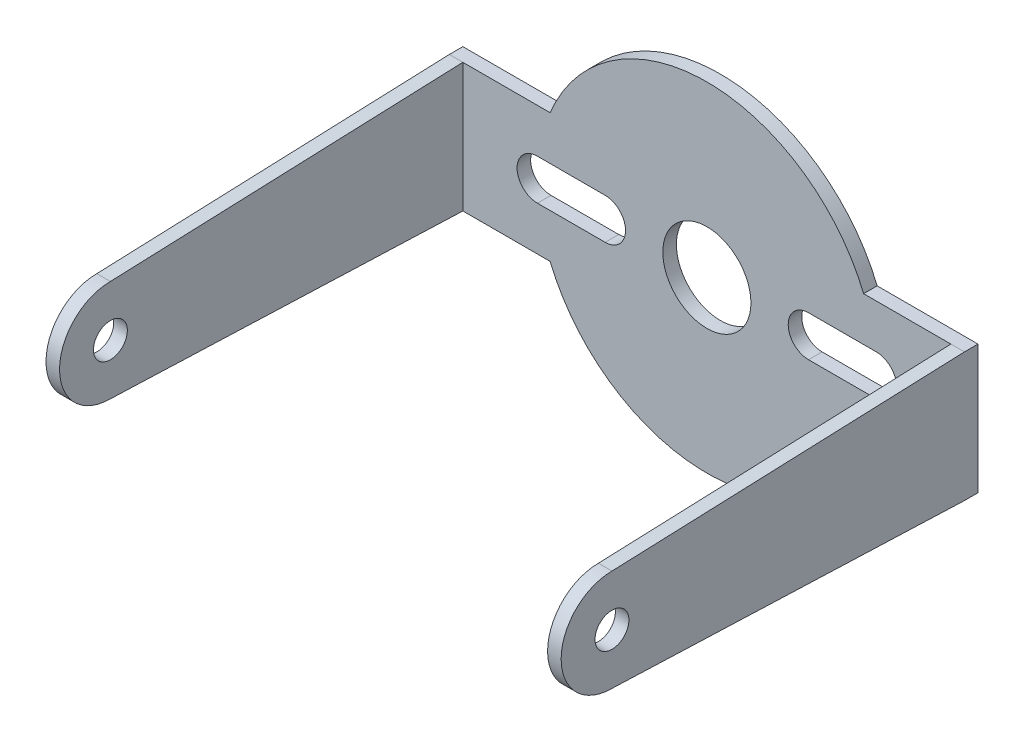
from build123d import *

# Parameters (mm, degrees)
SKETCH_1_R                = 3.25
EXTRUDE_1_DEPTH           = 1
HOLE_WIZARD_3_0_3_1_DEPTH = 1
SKETCH_7_R                = 1.25
EXTRUDE_2_DEPTH           = 1


# Read off the part's stored shape, not the designer's step: Ø3.0 (3) 直径槽口1
with BuildPart() as part:
    # 草图1 → 凸台-拉伸1 (new body)
    with BuildSketch(Plane.XY):
        with BuildLine():
            Line((11.56233108, 4.75), (19, 4.75))
            Line((19, 4.75), (19, -4.75))
            Line((19, -4.75), (11.56233108, -4.75))
            ThreePointArc((11.56233108, -4.75), (0, -12.5), (-11.56233108, -4.75))
            Line((-11.56233108, -4.75), (-19, -4.75))
            Line((-19, -4.75), (-19, 4.75))
            Line((-19, 4.75), (-11.56233108, 4.75))
            ThreePointArc((-11.56233108, 4.75), (0, 12.5), (11.56233108, 4.75))
        make_face()
        Circle(SKETCH_1_R, mode=Mode.SUBTRACT)
    extrude(amount=EXTRUDE_1_DEPTH)

    # Ø3.0 (3) 直径槽口1 outline → Ø3.0 (3) 直径槽口1 (cut)
    with BuildSketch(Plane.XY):
        with BuildLine():
            Line((7.5, -1.5), (12.5, -1.5))
            ThreePointArc((12.5, -1.5), (14, 0), (12.5, 1.5))
            Line((12.5, 1.5), (7.5, 1.5))
            ThreePointArc((7.5, 1.5), (6, 0), (7.5, -1.5))
        make_face()
        with BuildLine():
            ThreePointArc((-7.5, -1.5), (-6, 0), (-7.5, 1.5))
            Line((-7.5, 1.5), (-12.5, 1.5))
            ThreePointArc((-12.5, 1.5), (-14, 0), (-12.5, -1.5))
            Line((-12.5, -1.5), (-7.5, -1.5))
        make_face()
    extrude(amount=HOLE_WIZARD_3_0_3_1_DEPTH, mode=Mode.SUBTRACT)

    # 草图7 → 凸台-拉伸2 (add)
    with BuildSketch(Plane.ZY.offset(19)):
        with BuildLine():
            Line((1, 4.75), (27, 3.75))
            ThreePointArc((27, 3.75), (30.75, 0), (27, -3.75))
            Line((27, -3.75), (1, -4.75))
            Line((1, -4.75), (1, 4.75))
        make_face()
        with Locations((27, 0)):
            Circle(SKETCH_7_R, mode=Mode.SUBTRACT)
    extrude_2 = extrude(amount=-EXTRUDE_2_DEPTH)

    # 镜向1: 凸台-拉伸2 across plane
    add(extrude_2.mirror(Plane(origin=(0, 0, 0), x_dir=(0, 0, 1), z_dir=(1, 0, 0))))


solid = part.part
